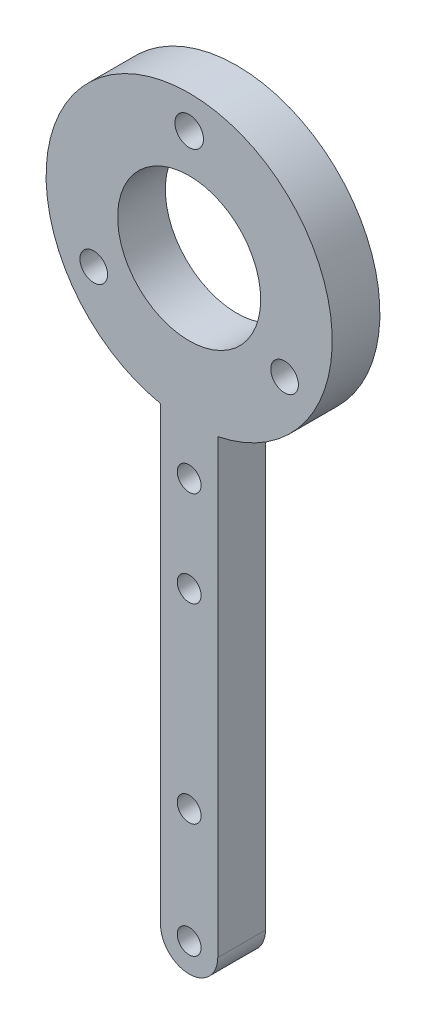
from build123d import *

# Parameters (mm, degrees)
ESQUISSE1_R             = 15
ESQUISSE1_R_2           = 1.45
ESQUISSE1_R_3           = 1.498803823
ESQUISSE1_R_4           = 7.5
BOSS_EXTRU_1_DEPTH      = 5
CONG_1_R                = 3
CONG_2_R                = 3
ENL_V_MAT_EXTRU_1_REACH = 68.895
ESQUISSE2_R             = 1.25


with BuildPart() as part:
    # Esquisse1 → Boss.-Extru.1 (new body)
    # profile 1 of 3: a face of its own
    with BuildSketch(Plane.XY):
        with BuildLine():
            ThreePointArc((3, -14.696938457), (1.50763443, -14.924042295), (0, -15))
            Line((0, -15), (0, -65))
            Line((0, -65), (3, -65))
            Line((3, -65), (3, -14.696938457))
        make_face()
    # profile 2 of 3: a face of its own
    with BuildSketch(Plane.XY):
        with BuildLine():
            Line((0, -65), (0, -15))
            ThreePointArc((0, -15), (-1.50763443, -14.924042295), (-3, -14.696938457))
            Line((-3, -14.696938457), (-3, -65))
            Line((-3, -65), (0, -65))
        make_face()
    # profile 3 of 3: a face of its own
    with BuildSketch(Plane.XY):
        Circle(ESQUISSE1_R)
        with Locations((10.002593414, -5.775)):
            Circle(ESQUISSE1_R_2, mode=Mode.SUBTRACT)
        with Locations((0, 11.55)):
            Circle(ESQUISSE1_R_3, mode=Mode.SUBTRACT)
        with Locations((-10.002593414, -5.775)):
            Circle(ESQUISSE1_R_2, mode=Mode.SUBTRACT)
        Circle(ESQUISSE1_R_4, mode=Mode.SUBTRACT)
    extrude(amount=BOSS_EXTRU_1_DEPTH)

    # Congé1
    cong_1_edges = [part.edges().sort_by_distance(p)[0] for p in [
        (3, -65, 2.5),
    ]]
    fillet(cong_1_edges, radius=CONG_1_R)

    # Congé2
    cong_2_edges = [part.edges().sort_by_distance(p)[0] for p in [
        (-3, -65, 2.5),
    ]]
    fillet(cong_2_edges, radius=CONG_2_R - 0.0001)  # a hair under: the kernel refuses the full size

    # Esquisse2 → Enlèv. mat.-Extru.1 (cut, up to next)
    with BuildSketch(Plane.XY.offset(5), mode=Mode.PRIVATE) as enl_v_mat_extru_1_sk1:
        with Locations((0, -20)):
            Circle(ESQUISSE2_R)
    enl_v_mat_extru_1_tool1 = extrude(enl_v_mat_extru_1_sk1.sketch, amount=-ENL_V_MAT_EXTRU_1_REACH, mode=Mode.PRIVATE) & part.part
    # Esquisse2 → Enlèv. mat.-Extru.1 (cut, up to next)
    with BuildSketch(Plane.XY.offset(5), mode=Mode.PRIVATE) as enl_v_mat_extru_1_sk2:
        with Locations((0, -30)):
            Circle(ESQUISSE2_R)
    enl_v_mat_extru_1_tool2 = extrude(enl_v_mat_extru_1_sk2.sketch, amount=-ENL_V_MAT_EXTRU_1_REACH, mode=Mode.PRIVATE) & part.part
    # Esquisse2 → Enlèv. mat.-Extru.1 (cut, up to next)
    with BuildSketch(Plane.XY.offset(5), mode=Mode.PRIVATE) as enl_v_mat_extru_1_sk3:
        with Locations((0, -50)):
            Circle(ESQUISSE2_R)
    enl_v_mat_extru_1_tool3 = extrude(enl_v_mat_extru_1_sk3.sketch, amount=-ENL_V_MAT_EXTRU_1_REACH, mode=Mode.PRIVATE) & part.part
    # Esquisse2 → Enlèv. mat.-Extru.1 (cut, up to next)
    with BuildSketch(Plane.XY.offset(5), mode=Mode.PRIVATE) as enl_v_mat_extru_1_sk4:
        with Locations((0, -62)):
            Circle(ESQUISSE2_R)
    enl_v_mat_extru_1_tool4 = extrude(enl_v_mat_extru_1_sk4.sketch, amount=-ENL_V_MAT_EXTRU_1_REACH, mode=Mode.PRIVATE) & part.part
    add(enl_v_mat_extru_1_tool1.solids().sort_by_distance((0, -20, 5))[0], mode=Mode.SUBTRACT)
    add(enl_v_mat_extru_1_tool2.solids().sort_by_distance((0, -30, 5))[0], mode=Mode.SUBTRACT)
    add(enl_v_mat_extru_1_tool3.solids().sort_by_distance((0, -50, 5))[0], mode=Mode.SUBTRACT)
    add(enl_v_mat_extru_1_tool4.solids().sort_by_distance((0, -62, 5))[0], mode=Mode.SUBTRACT)


solid = part.part
